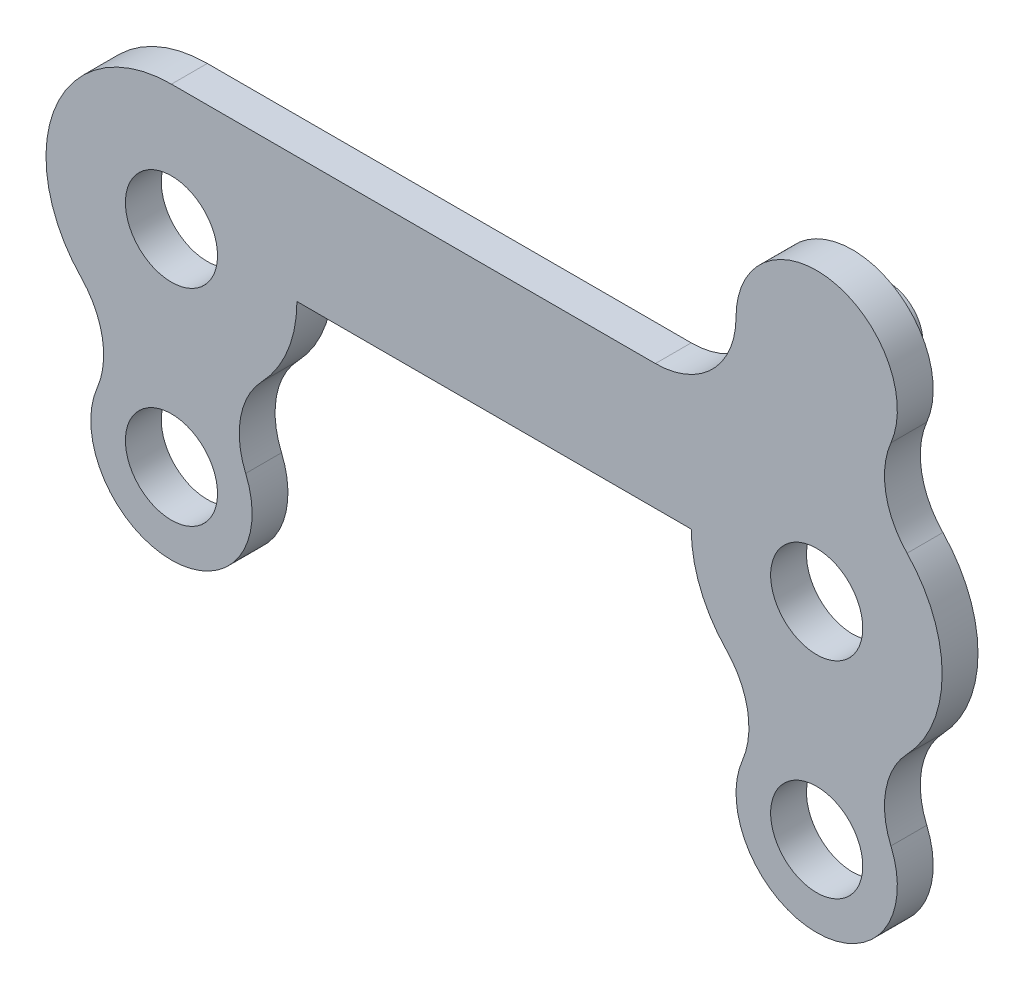
from build123d import *

# Parameters (mm, degrees)
SKETCH2_R                = 2.0399375
SKETCH2_R_2              = 1.5319375
BOSS_EXTRUDE1_DEPTH      = 1.5875
BOSS_EXTRUDE3_DEPTH      = 1.5875
BOSS_EXTRUDE3_DEPTH_BACK = 1.5875
SKETCH2_4_R              = 1.5319375


with BuildPart() as part:
    # Sketch2 → Boss-Extrude1 (new body)
    with BuildSketch(Plane.XY):
        with BuildLine():
            Line((21.43125, 5.55625), (0, 5.55625))
            ThreePointArc((0, 5.55625), (-5.113202022, 2.174184709), (-4.001636229, -3.854714199))
            ThreePointArc((-4.001636229, -3.854714199), (-3.061446645, -5.685103398), (-3.287058415, -7.730434766))
            ThreePointArc((-3.287058415, -7.730434766), (0, -12.7), (3.287058415, -7.730434766))
            ThreePointArc((3.287058415, -7.730434766), (3.061446641, -5.685103418), (4.0016362, -3.854714229))
            ThreePointArc((4.0016362, -3.854714229), (5.152960566, -2.078199091), (5.55625, 0))
            Line((5.55625, 0), (23.01875, 0))
            ThreePointArc((23.01875, 0), (23.422039385, -2.07819897), (24.573363619, -3.854714041))
            ThreePointArc((24.573363619, -3.854714041), (25.513553344, -5.685103337), (25.287941547, -7.730434854))
            ThreePointArc((25.287941547, -7.730434854), (28.575000048, -12.7), (31.862058415, -7.730434766))
            ThreePointArc((31.862058415, -7.730434766), (31.636446655, -5.685103342), (32.576636308, -3.854714117))
            ThreePointArc((32.576636308, -3.854714117), (34.13125, -7.3e-08), (32.576636409, 3.854714012))
            ThreePointArc((32.576636409, 3.854714012), (31.636446674, 5.685103241), (31.862058392, 7.730434711))
            ThreePointArc((31.862058392, 7.730434711), (29.288207306, 12.628071622), (25.003125, 9.128125))
            ThreePointArc((25.003125, 9.128125), (23.956947034, 6.602427966), (21.43125, 5.55625))
        make_face()
        Circle(SKETCH2_R, mode=Mode.SUBTRACT)
        with Locations((28.575, 0)):
            Circle(SKETCH2_R, mode=Mode.SUBTRACT)
        with Locations((28.575, 9.128125)):
            Circle(SKETCH2_R_2, mode=Mode.SUBTRACT)
        with Locations((0, -9.128125)):
            Circle(SKETCH2_R, mode=Mode.SUBTRACT)
        with Locations((28.575, -9.128125)):
            Circle(SKETCH2_R, mode=Mode.SUBTRACT)
    extrude(amount=BOSS_EXTRUDE1_DEPTH)

    # Sketch2<4> → Boss-Extrude3 (add, two sides: drawn at the far end of the back side and taken through both)
    with BuildSketch(Plane.XY.offset(-BOSS_EXTRUDE3_DEPTH_BACK)):
        with Locations((28.575, 9.128125)):
            Circle(SKETCH2_4_R)
    extrude(amount=BOSS_EXTRUDE3_DEPTH + BOSS_EXTRUDE3_DEPTH_BACK)


solid = part.part
